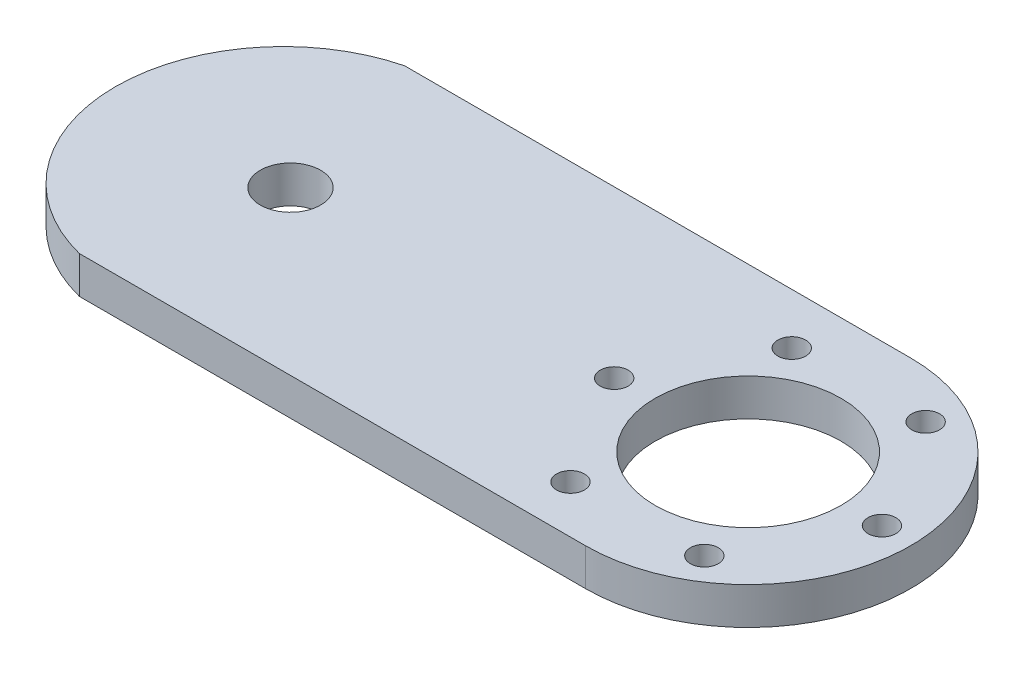
from build123d import *

# Parameters (mm, degrees)
SKETCH_1_R          = 6.5
SKETCH_1_R_2        = 20
EXTRUDE_1_DEPTH     = 8
SKETCH_2_R          = 3
CUT_EXTRUDE_1_DEPTH = 10


with BuildPart() as part:
    # Эскиз1 → Вытянуть1 (new body)
    with BuildSketch(Plane(origin=(0, 0, 0), x_dir=(1, 0, 0), z_dir=(0, 1, 0))):
        with BuildLine():
            Line((1.738556374, 18.516613497), (110.672099026, 18.516613497))
            ThreePointArc((110.672099026, 18.516613497), (145.672099026, -16.483386503), (110.672099026, -51.483386503))
            Line((110.672099026, -51.483386503), (1.738556374, -51.483386503))
            ThreePointArc((1.738556374, -51.483386503), (-25.499232193, -16.483386503), (1.738556374, 18.516613497))
        make_face()
        with Locations((12.165325646, -16.483386503)):
            Circle(SKETCH_1_R, mode=Mode.SUBTRACT)
        with Locations((110.670387559, -16.483386503)):
            Circle(SKETCH_1_R_2, mode=Mode.SUBTRACT)
    extrude(amount=EXTRUDE_1_DEPTH)

    # Эскиз2 → Вырез-Вытянуть1 (cut)
    with BuildSketch(Plane(origin=(0, 8, 0), x_dir=(1, 0, 0), z_dir=(0, 1, 0))):
        with Locations((96.021590781, 7.563843825)):
            Circle(SKETCH_2_R)
        with Locations((124.179862127, 8.221889416)):
            Circle(SKETCH_2_R)
        with Locations((138.828881998, -15.834866101)):
            Circle(SKETCH_2_R)
        with Locations((125.319630524, -40.549667208)):
            Circle(SKETCH_2_R)
        with Locations((97.161359178, -41.207712799)):
            Circle(SKETCH_2_R)
        with Locations((82.512339307, -17.150957282)):
            Circle(SKETCH_2_R)
    extrude(amount=-CUT_EXTRUDE_1_DEPTH, mode=Mode.SUBTRACT)


solid = part.part
